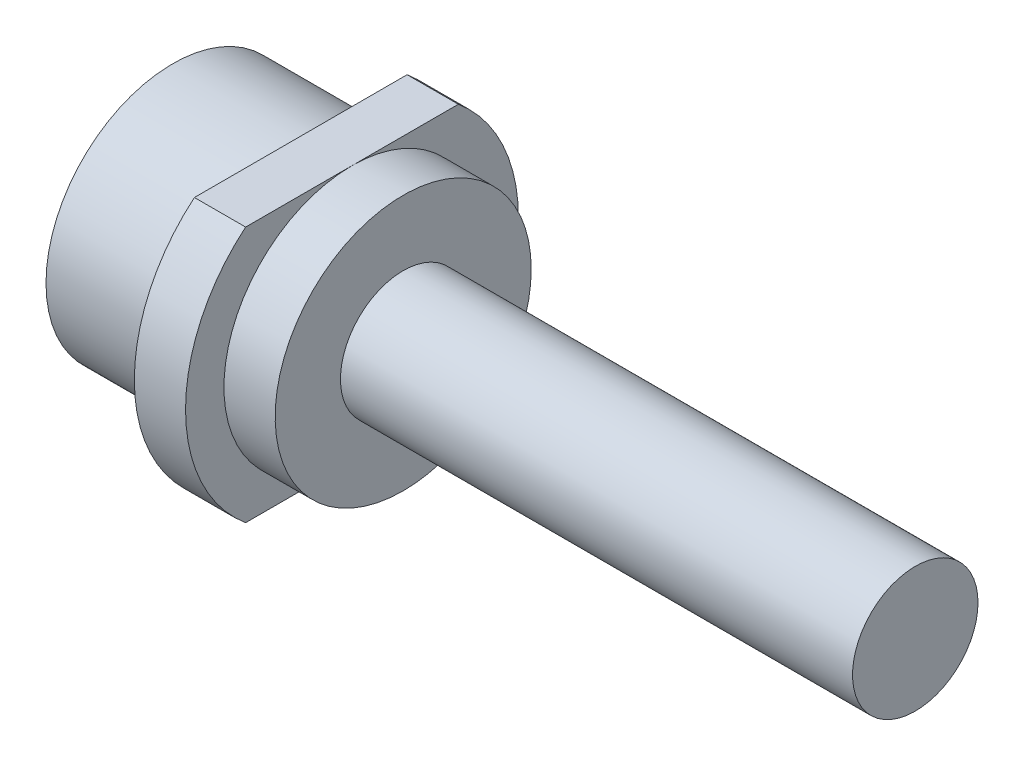
from build123d import *

# Parameters (mm, degrees)
EXTRUDE_1_DEPTH = 2
SKETCH_3_R      = 5
EXTRUDE_2_DEPTH = 2
SKETCH_4_R      = 2.45
EXTRUDE_3_DEPTH = 20
SKETCH_5_R      = 4.95
EXTRUDE_4_DEPTH = 5


with BuildPart() as part:
    # 草图2 → 凸台-拉伸1 (new body)
    with BuildSketch(Plane(origin=(0, 0, 0), x_dir=(0, 0, -1), z_dir=(1, 0, 0))):
        with BuildLine():
            Line((4.153311931, 5), (-4.153311931, 5))
            ThreePointArc((-4.153311931, 5), (-6.5, 0), (-4.153311931, -5))
            Line((-4.153311931, -5), (4.153311931, -5))
            ThreePointArc((4.153311931, -5), (6.5, 0), (4.153311931, 5))
        make_face()
    extrude(amount=EXTRUDE_1_DEPTH)

    # 草图3 → 凸台-拉伸2 (add)
    with BuildSketch(Plane(origin=(2, 0, 0), x_dir=(0, 0, -1), z_dir=(1, 0, 0))):
        Circle(SKETCH_3_R)
    extrude(amount=EXTRUDE_2_DEPTH)

    # 草图4 → 凸台-拉伸3 (add)
    with BuildSketch(Plane(origin=(4, 0, 0), x_dir=(0, 0, -1), z_dir=(1, 0, 0))):
        Circle(SKETCH_4_R)
    extrude(amount=EXTRUDE_3_DEPTH)

    # 草图5 → 凸台-拉伸4 (add)
    with BuildSketch(Plane.ZY):
        Circle(SKETCH_5_R)
    extrude(amount=EXTRUDE_4_DEPTH)


solid = part.part
